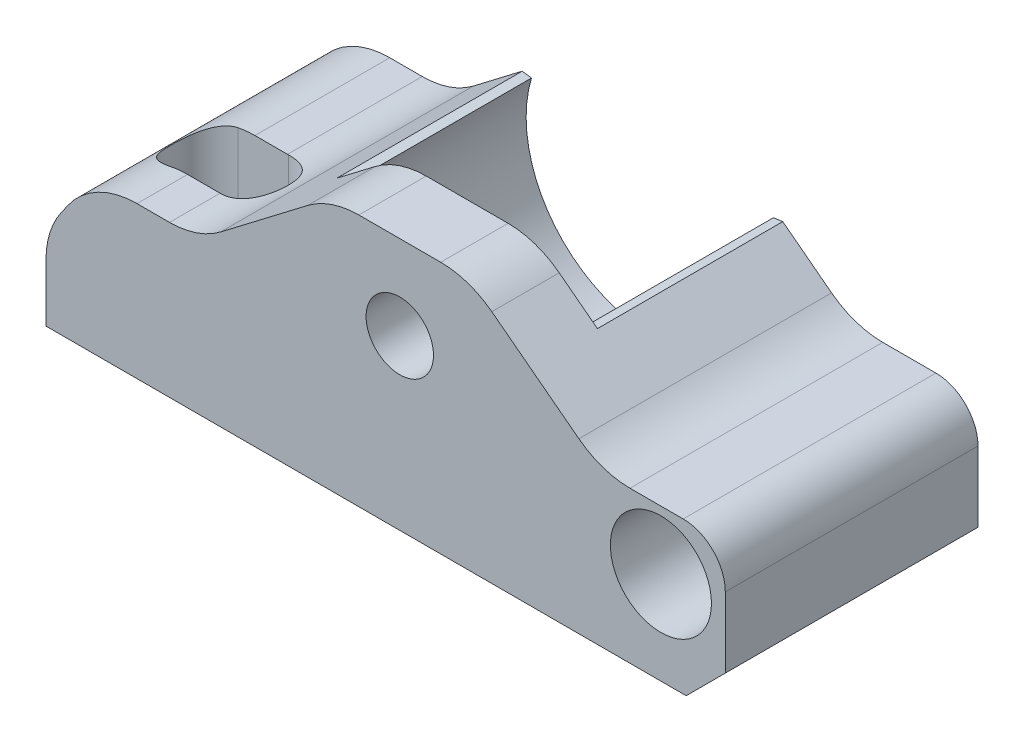
from build123d import *

# Parameters (mm, degrees)
SCHIZZO2_R                   = 2
SCHIZZO2_R_2                 = 1.343240654
ESTRUSIONE_ESTRUSIONE1_DEPTH = 15
SCHIZZO3_R                   = 7.5
TAGLIO_ESTRUSIONE1_DEPTH     = 11
SMUSSO3_SIZE                 = 1
RACCORDO1_R                  = 2.5
SMUSSO4_SIZE                 = 4
SMUSSO4_SIZE2                = 2.800830153
TAGLIO_ESTRUSIONE3_DEPTH     = 46.276925691
FILLET1_R                    = 5
FILLET3_R                    = 5
FILLET4_R                    = 5
FILLET5_R                    = 5
SKETCH1_R                    = 3
CUT_EXTRUDE1_DEPTH           = 5


with BuildPart() as part:
    # Schizzo2 → Estrusione-Estrusione1 (new body)
    with BuildSketch(Plane.XY):
        Polygon((-40, 0), (-2, 0), (0.321661039, 2.321661039), (0.321661039, 9), (-7.024563842, 9), (-14.880083854, 15), (-23.119916146, 15), (-30.975436158, 9), (-40, 9), align=None)
        with Locations((-19, 10)):
            Circle(SCHIZZO2_R, mode=Mode.SUBTRACT)
        with Locations((-3.5, 5.5)):
            Circle(SCHIZZO2_R_2, mode=Mode.SUBTRACT)
    extrude(amount=-ESTRUSIONE_ESTRUSIONE1_DEPTH)

    # Schizzo3 → Taglio-Estrusione1 (cut)
    with BuildSketch(Plane(origin=(0, 0, -15), x_dir=(-1, 0, 0), z_dir=(0, 0, -1))):
        with Locations((19, 10)):
            Circle(SCHIZZO3_R)
    extrude(amount=-TAGLIO_ESTRUSIONE1_DEPTH, mode=Mode.SUBTRACT)

    # Smusso3
    # the kernel refuses this chamfer: 1, 0.730975935 mm, written as the material it takes off along each edge
    with BuildSketch(Plane(origin=(-25.938580935, 12.847120406, -4), x_dir=(-0.7947073367402627, -0.6069927914985472, 0), z_dir=(0, 0, -1))) as smusso3_piece_1:
        with BuildLine():
            Line((SMUSSO3_SIZE, 0), (0.605555486, -0.394444514))
            ThreePointArc((0.605555486, -0.394444514), (0.30405624, -0.187661825), (0, 0))
            Line((0, 0), (SMUSSO3_SIZE, 0))
        make_face()
    extrude(amount=13.571682988, mode=Mode.SUBTRACT)
    with BuildSketch(Plane(origin=(-12.061419065, 12.847120406, -4), x_dir=(0.33460224521765425, -0.94235945238285, 0), z_dir=(0, 0, -1))) as smusso3_piece_2:
        with BuildLine():
            Line((0.722692134, 0), (SMUSSO3_SIZE * 0.837916253761, -SMUSSO3_SIZE * 0.545798819789))
            Line((SMUSSO3_SIZE * 0.837916253761, -SMUSSO3_SIZE * 0.545798819789), (0, 0))
            ThreePointArc((0, 0), (0.357199268, -0.008708643), (0.722692134, 0))
        make_face()
    extrude(amount=13.571682988, mode=Mode.SUBTRACT)

    # Raccordo1
    raccordo1_edges = [part.edges().sort_by_distance(p)[0] for p in [
        (0.321661039, 9, -7.5),
    ]]
    fillet(raccordo1_edges, radius=RACCORDO1_R)

    # Smusso4
    smusso4_edges = [part.edges().sort_by_distance(p)[0] for p in [
        (-40, 9, -7.5),
    ]]
    smusso4_side = [part.faces().sort_by_distance(p)[0] for p in [
        (-40, 4.5, -7.5),
    ]]
    chamfer(smusso4_edges, length=SMUSSO4_SIZE, length2=SMUSSO4_SIZE2, reference=smusso4_side[0])

    # Schizzo5 → Taglio-Estrusione3 (cut, through all)
    with BuildSketch(Plane.XZ):
        with BuildLine():
            Line((-35.611900304, -3), (-32.611900304, -3))
            ThreePointArc((-32.611900304, -3), (-30.611900304, -5), (-32.611900304, -7))
            Line((-32.611900304, -7), (-35.611900304, -7))
            ThreePointArc((-35.611900304, -7), (-37.611900304, -5), (-35.611900304, -3))
        make_face()
    extrude(amount=-TAGLIO_ESTRUSIONE3_DEPTH, mode=Mode.SUBTRACT)

    # Fillet1
    fillet1_edges = [part.edges().sort_by_distance(p)[0] for p in [
        (-7.024563842, 9, -7.5),
    ]]
    fillet(fillet1_edges, radius=FILLET1_R)

    # Fillet3
    # the kernel refuses this fillet: 5 mm, written as the material it takes off along each edge
    with BuildSketch(Plane(origin=(-37.199169847, 9, 0.290299162), x_dir=(-0.573576436351049, -0.8191520442889898, 0), z_dir=(0, 0, -1))) as fillet3_piece_1:
        with BuildLine():
            CenterArc((FILLET3_R * 0.520567050552, -FILLET3_R), FILLET3_R, 90, 55)
            Line((-FILLET3_R * 0.298584993737, -FILLET3_R * 0.426423563649), (0, 0))
            Line((0, 0), (FILLET3_R * 0.520567050552, 0))
        make_face()
    extrude(amount=21.797387294, mode=Mode.SUBTRACT)
    with BuildSketch(Plane(origin=(-40, 5, 3.941234861), x_dir=(0, -1, 0), z_dir=(0, 0, -1))) as fillet3_piece_2:
        with BuildLine():
            CenterArc((FILLET3_R * 0.315298788879, -FILLET3_R), FILLET3_R, 90, 35)
            Line((-FILLET3_R * 0.258277647472, -FILLET3_R * 0.180847955711), (0, 0))
            Line((0, 0), (FILLET3_R * 0.315298788879, 0))
        make_face()
    extrude(amount=22.882469722, mode=Mode.SUBTRACT)
    with BuildSketch(Plane(origin=(-37.199169847, 9, 6.507088132), x_dir=(-0.573576436351049, -0.8191520442889898, 0), z_dir=(0, 0, -1))) as fillet3_piece_3:
        with BuildLine():
            CenterArc((FILLET3_R * 0.520567050552, -FILLET3_R), FILLET3_R, 90, 55)
            Line((-FILLET3_R * 0.298584993737, -FILLET3_R * 0.426423563649), (0, 0))
            Line((0, 0), (FILLET3_R * 0.520567050552, 0))
        make_face()
    extrude(amount=16.797387294, mode=Mode.SUBTRACT)

    # Fillet4
    fillet4_edges = [part.edges().sort_by_distance(p)[0] for p in [
        (-14.880083854, 15, -2),
        (-23.119916146, 15, -2),
    ]]
    fillet(fillet4_edges, radius=FILLET4_R)

    # Fillet5
    # the kernel refuses this fillet: 5 mm, written as the material it adds along each edge
    with BuildSketch(Plane(origin=(-30.975436158, 9, -1.922117515), x_dir=(0.794707336740263, 0.6069927914985467, 0), z_dir=(0, 0, -1))) as fillet5_piece_1_section:
        with BuildLine():
            CenterArc((FILLET5_R * 0.338212687424, -FILLET5_R), FILLET5_R, 90, 37.372378399)
            Line((-FILLET5_R * 0.268780104075, -FILLET5_R * 0.20529266326), (0, 0))
            Line((0, 0), (FILLET5_R * 0.338212687424, 0))
        make_face()
    fillet5_piece_1 = extrude(amount=13.077882485, mode=Mode.PRIVATE)
    fillet5_piece_1 = fillet5_piece_1 - Plane(origin=(-32.611900304, 9, -5), x_dir=(0, 0, 1), z_dir=(0, -1, 0)) * Cylinder(2, 33, mode=Mode.PRIVATE)
    add(fillet5_piece_1)
    with BuildSketch(Plane(origin=(-30.975436158, 9, 0), x_dir=(0.794707336740263, 0.6069927914985467, 0), z_dir=(0, 0, -1))) as fillet5_piece_2_section:
        with BuildLine():
            CenterArc((FILLET5_R * 0.338212687424, -FILLET5_R), FILLET5_R, 90, 37.372378399)
            Line((-FILLET5_R * 0.268780104075, -FILLET5_R * 0.20529266326), (0, 0))
            Line((0, 0), (FILLET5_R * 0.338212687424, 0))
        make_face()
    fillet5_piece_2 = extrude(amount=8.077882485, mode=Mode.PRIVATE)
    fillet5_piece_2 = fillet5_piece_2 - Plane(origin=(-32.611900304, 9, -5), x_dir=(0, 0, 1), z_dir=(0, -1, 0)) * Cylinder(2, 23, mode=Mode.PRIVATE)
    add(fillet5_piece_2)

    # Sketch1 → Cut-Extrude1 (cut)
    with BuildSketch(Plane.XY):
        with Locations((-3.5, 5.5)):
            Circle(SKETCH1_R)
    extrude(amount=-CUT_EXTRUDE1_DEPTH, mode=Mode.SUBTRACT)


solid = part.part
